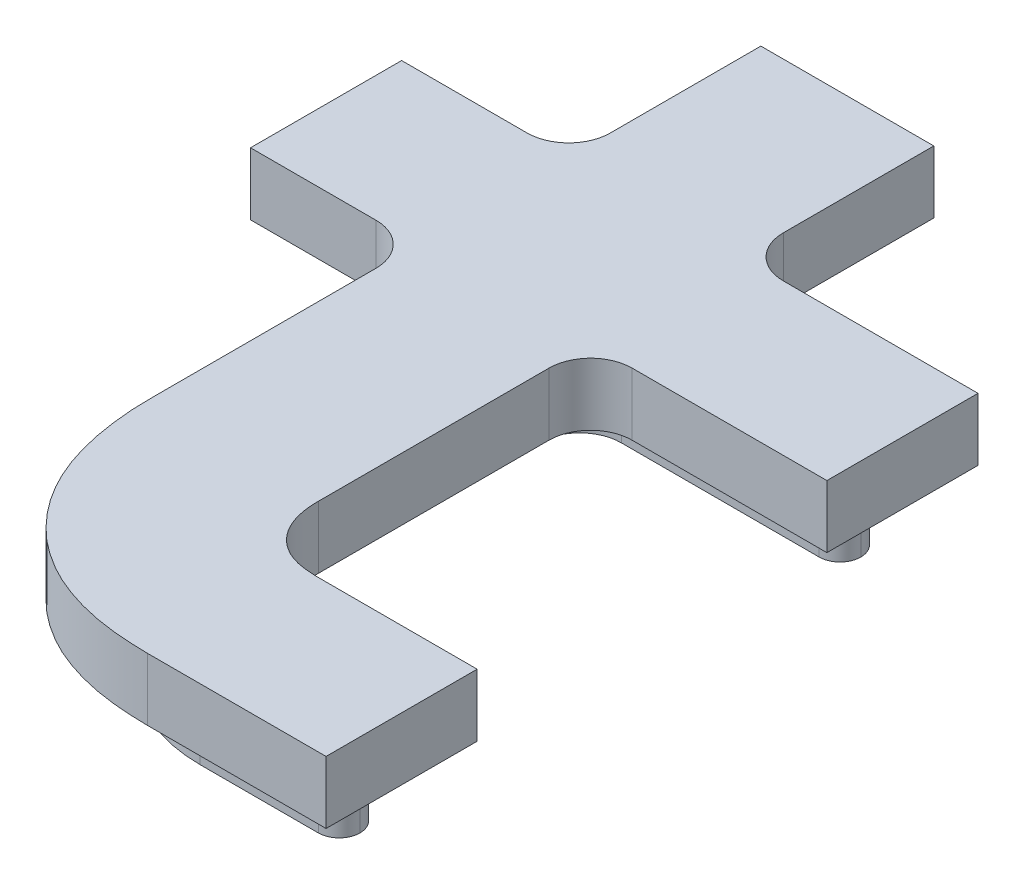
from build123d import *

# Parameters (mm, degrees)
EXTRUDE_T_DEPTH        = 15
SKETCH_937_W           = 118.457051
SKETCH_937_H           = 10
EXTRUDE_1_DEPTH        = 15
FILLET_1172_R          = 5
FILLET_1670_R          = 10
FILLET_1882_R          = 10
SKETCH_2094_R          = 1.5
CUT_EXTRUDE_2102_DEPTH = 244.711622867


with BuildPart() as part:
    # Эскиз t → t (new body)
    with BuildSketch(Plane(origin=(0, 0, 0), x_dir=(1, 0, 0), z_dir=(0, 1, 0))):
        with BuildLine():
            Line((0, 153.846153846), (40.13974359, 153.846153846))
            Line((40.13974359, 153.846153846), (40.13974359, 200))
            Line((40.13974359, 200), (81.686217949, 200))
            Line((81.686217949, 200), (81.686217949, 153.846153846))
            Line((81.686217949, 153.846153846), (138.457051282, 153.846153846))
            Line((138.457051282, 153.846153846), (138.457051282, 117.548076923))
            Line((138.457051282, 117.548076923), (81.686217949, 117.548076923))
            Line((81.686217949, 117.548076923), (81.686217949, 52.243589744))
            add(Edge.make_bspline(
                [(81.686217949, 52.243589744), (81.655267201, 49.982948441), (82.085389497, 46.690532241), (83.817672815, 42.793259528), (85.603921155, 40.439849904), (87.847865612, 38.561179508), (91.543310131, 36.686733749), (94.758311571, 36.350436228), (96.910576923, 36.298076923)],
                knots=[0, 0, 0, 0, 0.27148881, 0.391200884, 0.507818538, 0.622673608, 0.739445184, 1, 1, 1, 1], degree=3))
            Line((96.910576923, 36.298076923), (135.692628205, 36.298076923))
            Line((135.692628205, 36.298076923), (135.692628205, 0))
            Line((135.692628205, 0), (92.743910256, 0))
            add(Edge.make_bspline(
                [(92.743910256, 0), (88.849192705, 0.050339472), (83.116455127, 0.365762726), (75.810535171, 1.898538288), (70.797203285, 3.478754574), (66.08408468, 5.454229708), (61.749524849, 7.981859361), (57.691359691, 10.855934374), (54.053352032, 14.254057303), (50.767538722, 18.006446438), (47.908525609, 22.119844392), (45.483732962, 26.56295255), (43.519863299, 31.361705258), (42.002327108, 36.504881897), (40.54984301, 43.989384334), (40.084701759, 49.821816441), (40.13974359, 53.806089744)],
                knots=[0, 0, 0, 0, 0.137098935, 0.200908089, 0.261934675, 0.321669044, 0.380133534, 0.437984068, 0.496125333, 0.554687761, 0.613033376, 0.671858669, 0.73227727, 0.794962552, 0.860057524, 1, 1, 1, 1], degree=3))
            Line((40.13974359, 53.806089744), (40.13974359, 117.548076923))
            Line((40.13974359, 117.548076923), (0, 117.548076923))
            Line((0, 117.548076923), (0, 153.846153846))
        make_face()
    extrude(amount=EXTRUDE_T_DEPTH)

    # Sketch 937 → Вытянуть-Тонкостенный1 (add)
    with BuildSketch(Plane(origin=(0, 0, 0), x_dir=(1, 0, 0), z_dir=(0, 1, 0))):
        with BuildLine():
            Line((55.913237, 190), (55.913237, 49.511337503))
            ThreePointArc((55.913237, 49.511337503), (66.563507798, 23.799309298), (92.275536003, 13.1490385))
            Line((92.275536003, 13.1490385), (125.697051, 13.1490385))
            Line((125.697051, 13.1490385), (125.697051, 23.1490385))
            Line((125.697051, 23.1490385), (92.275536003, 23.1490385))
            ThreePointArc((92.275536003, 23.1490385), (73.63457561, 30.87037711), (65.913237, 49.511337503))
            Line((65.913237, 49.511337503), (65.913237, 190))
            Line((65.913237, 190), (55.913237, 190))
        make_face()
        with Locations((69.2285255, 135.6990385)):
            Rectangle(SKETCH_937_W, SKETCH_937_H)
    extrude(amount=-EXTRUDE_1_DEPTH)

    # Fillet 1172
    fillet_1172_edges = [part.edges().sort_by_distance(p)[0] for p in [
        (128.457051, -7.5, -140.6990385),
        (128.457051, -7.5, -130.6990385),
        (125.697051, -7.5, -23.1490385),
        (125.697051, -7.5, -13.1490385),
        (10, -7.5, -130.6990385),
        (10, -7.5, -140.6990385),
        (55.913237, -7.5, -190),
        (65.913237, -7.5, -190),
    ]]
    fillet(fillet_1172_edges, radius=FILLET_1172_R - 0.0001)  # a hair under: the kernel refuses the full size

    # Fillet 1670
    fillet_1670_edges = [part.edges().sort_by_distance(p)[0] for p in [
        (55.913237, -7.5, -140.6990385),
        (65.913237, -7.5, -130.6990385),
        (65.913237, -7.5, -140.6990385),
        (55.913237, -7.5, -130.6990385),
    ]]
    fillet(fillet_1670_edges, radius=FILLET_1670_R)

    # Fillet 1882
    fillet_1882_edges = [part.edges().sort_by_distance(p)[0] for p in [
        (40.13974359, 7.5, -153.846153846),
        (81.686217949, 7.5, -153.846153846),
        (81.686217949, 7.5, -117.548076923),
        (40.13974359, 7.5, -117.548076923),
    ]]
    fillet(fillet_1882_edges, radius=FILLET_1882_R)

    # Sketch 2094 → Cut-Extrude 2102 (cut, through all)
    with BuildSketch(Plane(origin=(0, 0, 0), x_dir=(1, 0, 0), z_dir=(0, 1, 0))):
        with Locations(Location((60.913237, 135.699039, 0), (0, 0, 270))):
            Circle(SKETCH_2094_R)
        with Locations(Location((120.697051, 18.149039, 0), (0, 0, 270))):
            Circle(SKETCH_2094_R)
        with Locations(Location((123.457051, 135.699039, 0), (0, 0, 270))):
            Circle(SKETCH_2094_R)
    extrude(amount=-CUT_EXTRUDE_2102_DEPTH, mode=Mode.SUBTRACT)


solid = part.part
